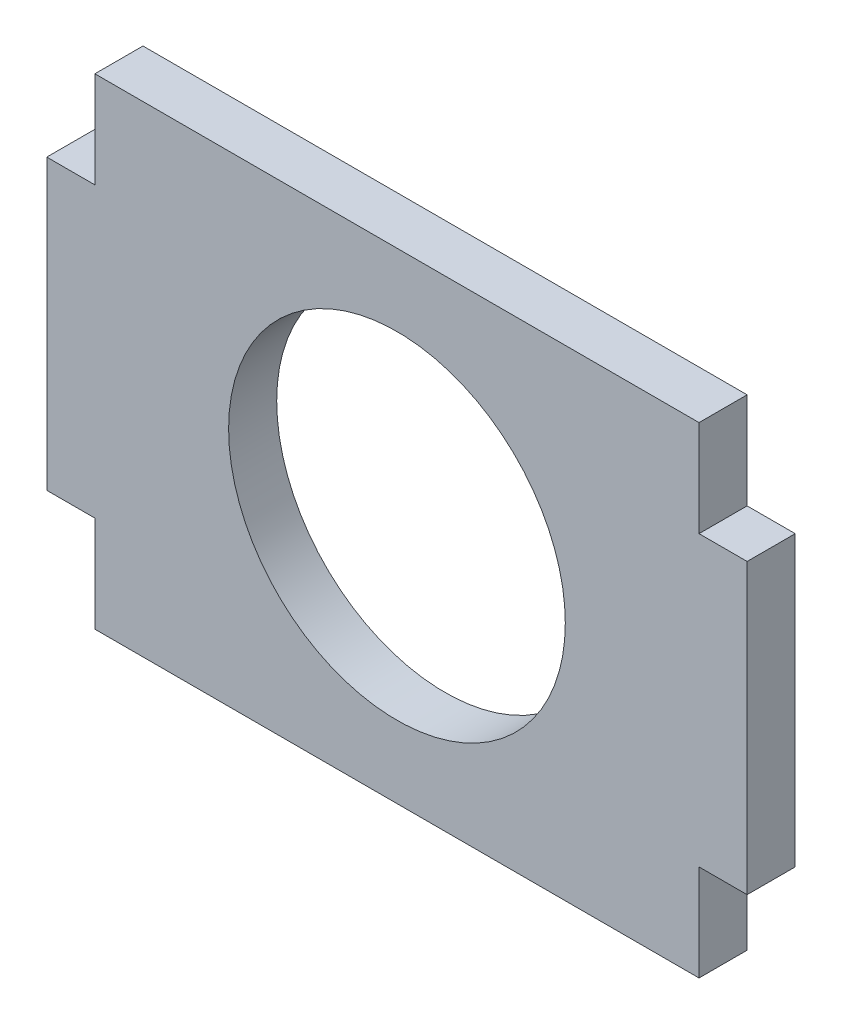
from build123d import *

# Parameters (mm, degrees)
SKETCH1_R           = 11.1125
BOSS_EXTRUDE1_DEPTH = 3.175


with BuildPart() as part:
    # Sketch1 → Boss-Extrude1 (new body)
    with BuildSketch(Plane.XY):
        Polygon((-23.114, -9.525), (-23.114, 9.525), (-19.939, 9.525), (-19.939, 15.875), (19.939, 15.875), (19.939, 9.525), (23.114, 9.525), (23.114, -9.525), (19.939, -9.525), (19.939, -15.875), (-19.939, -15.875), (-19.939, -9.525), align=None)
        Circle(SKETCH1_R, mode=Mode.SUBTRACT)
    extrude(amount=BOSS_EXTRUDE1_DEPTH)


solid = part.part
